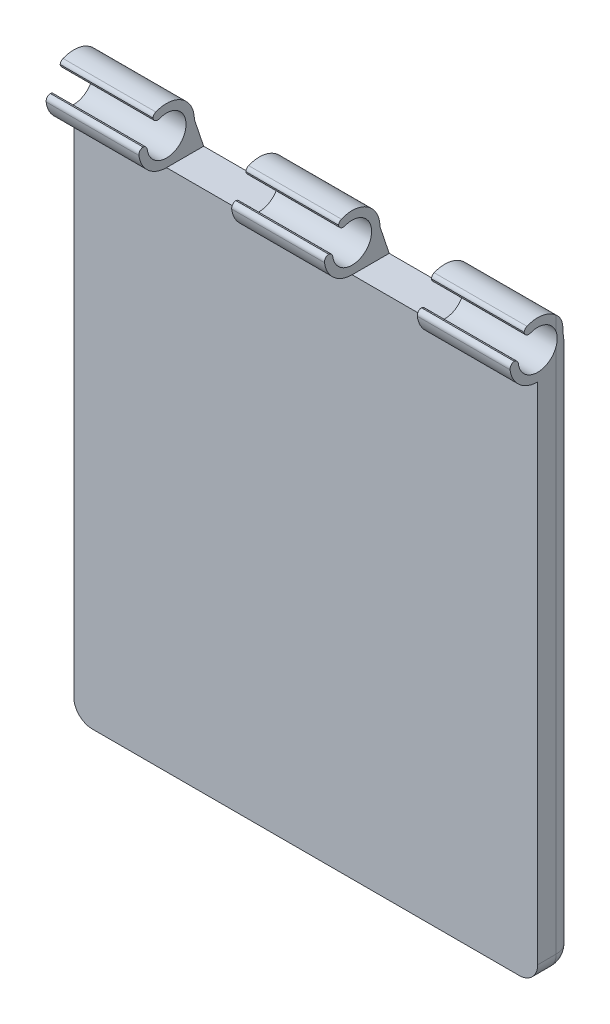
from build123d import *

# Parameters (mm, degrees)
SKETCH1_W           = 25
SKETCH1_H           = 28.2
BOSS_EXTRUDE1_DEPTH = 2
BOSS_EXTRUDE2_DEPTH = 5
LPATTERN1_COUNT     = 3
LPATTERN1_PITCH     = 10
SKETCH6_R           = 1.050000034
CUT_EXTRUDE1_DEPTH  = 31.490326335
FILLET1_R           = 1
FILLET2_R           = 1
SKETCH7_W           = 1.937328833
SKETCH7_H           = 1.211322367
CUT_EXTRUDE2_DEPTH  = 31.490326484
FILLET7_R           = 0.254


with BuildPart() as part:
    # Sketch1 → Boss-Extrude1 (new body)
    with BuildSketch(Plane.XY):
        Rectangle(SKETCH1_W, SKETCH1_H)
    extrude(amount=BOSS_EXTRUDE1_DEPTH)

    # Sketch5 → Boss-Extrude2 (add)
    with BuildSketch(Plane.ZY.offset(12.5)):
        with BuildLine():
            Line((0.5, 15.6), (0, 14.1))
            Line((0, 14.1), (2, 14.1))
            ThreePointArc((2, 14.1), (3.060660172, 16.660660172), (0.5, 15.6))
        make_face()
    boss_extrude2 = extrude(amount=-BOSS_EXTRUDE2_DEPTH)

    # LPattern1: Boss-Extrude2 ×3
    with Locations(*[(i * LPATTERN1_PITCH, 0, 0) for i in range(1, LPATTERN1_COUNT)]):
        add(boss_extrude2)

    # Sketch6 → Cut-Extrude1 (cut, through all)
    with BuildSketch(Plane.ZY.offset(12.5)):
        with Locations((2, 15.6)):
            Circle(SKETCH6_R)
    extrude(amount=-CUT_EXTRUDE1_DEPTH, mode=Mode.SUBTRACT)

    # Fillet1
    # the kernel refuses this fillet: 1 mm, written as the material it takes off along each edge
    with BuildSketch(Plane(origin=(12.5, -20.1, 0), x_dir=(0, 0, 1), z_dir=(0, 1, 0)), Plane(origin=(-12.5, 20.1, 0), x_dir=(0, 0, 1), z_dir=(0, -1, 0))) as fillet1_piece_1:
        with BuildLine():
            CenterArc((FILLET1_R, -FILLET1_R), FILLET1_R, 90, 90)
            Line((0, -FILLET1_R), (-FILLET1_R * 0.02, -FILLET1_R))
            Line((-FILLET1_R * 0.02, -FILLET1_R), (-FILLET1_R * 0.02, FILLET1_R * 0.02))
            Line((-FILLET1_R * 0.02, FILLET1_R * 0.02), (FILLET1_R, FILLET1_R * 0.02))
            Line((FILLET1_R, FILLET1_R * 0.02), (FILLET1_R, 0))
        make_face()
    extrude(amount=40.2, mode=Mode.SUBTRACT)
    with BuildSketch(Plane(origin=(-18.5, -14.1, 0), x_dir=(0, 0, 1), z_dir=(1, 0, 0))) as fillet1_piece_2:
        with BuildLine():
            CenterArc((FILLET1_R, -FILLET1_R), FILLET1_R, 90, 90)
            Line((0, -FILLET1_R), (-FILLET1_R * 0.02, -FILLET1_R))
            Line((-FILLET1_R * 0.02, -FILLET1_R), (-FILLET1_R * 0.02, FILLET1_R * 0.02))
            Line((-FILLET1_R * 0.02, FILLET1_R * 0.02), (FILLET1_R, FILLET1_R * 0.02))
            Line((FILLET1_R, FILLET1_R * 0.02), (FILLET1_R, 0))
        make_face()
    extrude(amount=37, mode=Mode.SUBTRACT)

    # Fillet2
    # the kernel refuses this fillet: 1 mm, written as the material it takes off along each edge
    with BuildSketch(Plane(origin=(-11.5, -13.1, 1), x_dir=(-1, 0, 0), z_dir=(0, -1, 0))) as fillet2_piece_1_section:
        Polygon((0, 0), (FILLET2_R, 0), (FILLET2_R, FILLET2_R), (0, FILLET2_R), align=None)
    fillet2_piece_1 = extrude(amount=FILLET2_R, mode=Mode.PRIVATE)
    fillet2_piece_1 = fillet2_piece_1 - Plane(origin=(-11.5, -13.1, 1), x_dir=(0.7071067811865475, 0, 0.7071067811865475), z_dir=(0, -1, 0)) * Sphere(FILLET2_R, mode=Mode.PRIVATE)
    add(fillet2_piece_1, mode=Mode.SUBTRACT)
    with BuildSketch(Plane(origin=(11.5, -13.1, 1), x_dir=(1, 0, 0), z_dir=(0, -1, 0))) as fillet2_piece_2_section:
        Polygon((0, 0), (FILLET2_R, 0), (FILLET2_R, -FILLET2_R), (0, -FILLET2_R), align=None)
    fillet2_piece_2 = extrude(amount=FILLET2_R, mode=Mode.PRIVATE)
    fillet2_piece_2 = fillet2_piece_2 - Plane(origin=(11.5, -13.1, 1), x_dir=(-0.7071067811865475, 0, 0.7071067811865475), z_dir=(0, -1, 0)) * Sphere(FILLET2_R, mode=Mode.PRIVATE)
    add(fillet2_piece_2, mode=Mode.SUBTRACT)
    with BuildSketch(Plane(origin=(12.5, -14.1, 1), x_dir=(-1, 0, 0), z_dir=(0, 0, 1))) as fillet2_piece_3:
        with BuildLine():
            CenterArc((FILLET2_R, -FILLET2_R), FILLET2_R, 90, 90)
            Line((0, -FILLET2_R), (0, 0))
            Line((0, 0), (FILLET2_R, 0))
        make_face()
    extrude(amount=3.5, mode=Mode.SUBTRACT)
    with BuildSketch(Plane(origin=(-12.5, -14.1, 1), x_dir=(1, 0, 0), z_dir=(0, 0, 1))) as fillet2_piece_4:
        with BuildLine():
            CenterArc((FILLET2_R, FILLET2_R), FILLET2_R, 180, 90)
            Line((0, FILLET2_R), (0, 0))
            Line((0, 0), (FILLET2_R, 0))
        make_face()
    extrude(amount=3.5, mode=Mode.SUBTRACT)

    # Sketch7 → Cut-Extrude2 (cut, through all)
    with BuildSketch(Plane.ZY.offset(12.5)):
        with Locations((3.702300239, 16.302688342)):
            Rectangle(SKETCH7_W, SKETCH7_H)
    extrude(amount=-CUT_EXTRUDE2_DEPTH, mode=Mode.SUBTRACT)

    # Fillet7
    # the kernel refuses this fillet: 0.254 mm, written as the material it takes off along each edge
    with BuildSketch(Plane(origin=(-6.784662672, 15.697027158, 3.496858621), x_dir=(0, -0.999525916105083, -0.03078868354273752), z_dir=(-1, 0, 0))) as fillet7_piece_1:
        with BuildLine():
            CenterArc((0.26190884, -0.252842039), FILLET7_R, 84.526905726, 97.237434721)
            Line((0.008029258, -0.260662364), (0, 0))
            ThreePointArc((0, 0), (0.143067466, 0.006838354), (0.286134931, 0))
        make_face()
    extrude(amount=6.430674656, mode=Mode.SUBTRACT)
    with BuildSketch(Plane(origin=(-6.877474788, 15.697027158, 3.045507437), x_dir=(0, 0, 1), z_dir=(-1, 0, 0))) as fillet7_piece_2:
        with BuildLine():
            CenterArc((0.249010085, -0.254), FILLET7_R, 90, 83.086084758)
            ThreePointArc((-0.003142862, -0.223424002), (0.004388728, -0.111795842), (0, 0))
            Line((0, 0), (0.249010085, 0))
        make_face()
    extrude(amount=6.245050424, mode=Mode.SUBTRACT)
    with BuildSketch(Plane(origin=(-6.34649613, 16.351184765, 2.733635822), x_dir=(0, 1, 0), z_dir=(-1, 0, 0)), Plane(origin=(13.65350387, 16.351184765, 2.733635822), x_dir=(0, 1, 0), z_dir=(-1, 0, 0)), Plane(origin=(3.65350387, 16.351184765, 2.733635822), x_dir=(0, 1, 0), z_dir=(-1, 0, 0))) as fillet7_piece_3:
        with BuildLine():
            CenterArc((0.461401548, 0.254), FILLET7_R, 158.418835743, 111.581164257)
            ThreePointArc((0.225207594, 0.347425994), (0.129898026, 0.162502575), (0, 0))
            Line((0, 0), (0.461401548, 0))
        make_face()
    extrude(amount=7.30700774, mode=Mode.SUBTRACT)
    with BuildSketch(Plane(origin=(-12.934394729, 16.908349525, 2.733635822), x_dir=(0, -1, 0), z_dir=(1, 0, 0)), Plane(origin=(7.065605271, 16.908349525, 2.733635822), x_dir=(0, -1, 0), z_dir=(1, 0, 0)), Plane(origin=(-2.934394729, 16.908349525, 2.733635822), x_dir=(0, -1, 0), z_dir=(1, 0, 0))) as fillet7_piece_4:
        with BuildLine():
            CenterArc((0.158364535, 0.254), FILLET7_R, 202.640044459, 67.359955541)
            ThreePointArc((-0.076062582, 0.156225121), (-0.040295304, 0.077010263), (0, 0))
            Line((0, 0), (0.158364535, 0))
        make_face()
    extrude(amount=5.868789458, mode=Mode.SUBTRACT)
    with BuildSketch(Plane(origin=(13.215337328, 15.697027158, 3.496858621), x_dir=(0, 0, -1), z_dir=(-1, 0, 0)), Plane(origin=(3.215337328, 15.697027158, 3.496858621), x_dir=(0, 0, -1), z_dir=(-1, 0, 0))) as fillet7_piece_5:
        with BuildLine():
            CenterArc((0.260785999, 0.254), FILLET7_R, 172.762565279, 97.237434721)
            ThreePointArc((0.008809718, 0.285999279), (-0.002430253, 0.143210184), (0, 0))
            Line((0, 0), (0.260785999, 0))
        make_face()
    extrude(amount=6.430674656, mode=Mode.SUBTRACT)
    with BuildSketch(Plane(origin=(13.122525212, 15.697027158, 3.045507437), x_dir=(0, -0.999901077195103, -0.014065412332113414), z_dir=(-1, 0, 0)), Plane(origin=(3.122525212, 15.697027158, 3.045507437), x_dir=(0, -0.999901077195103, -0.014065412332113414), z_dir=(-1, 0, 0))) as fillet7_piece_6:
        with BuildLine():
            CenterArc((0.250472444, 0.252558067), FILLET7_R, 180.805915338, 83.086084758)
            Line((-0.00350243, 0.248985452), (0, 0))
            ThreePointArc((0, 0), (0.111723053, 0.005960748), (0.223446106, 0))
        make_face()
    extrude(amount=6.245050424, mode=Mode.SUBTRACT)


solid = part.part
